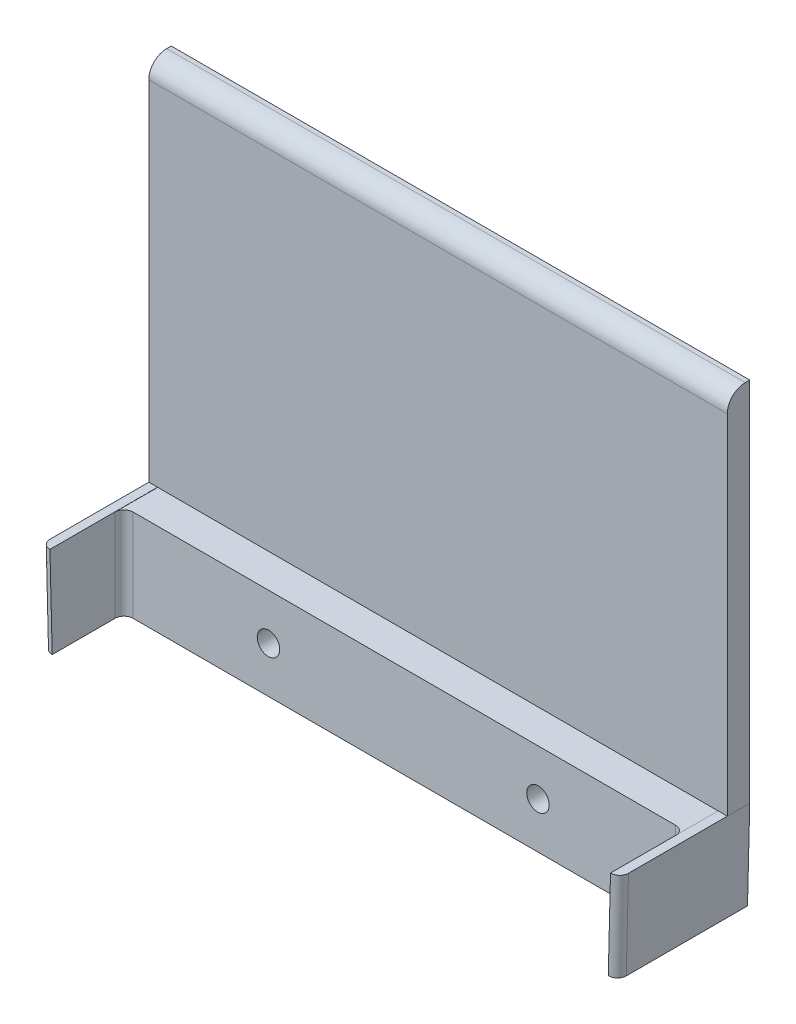
from build123d import *

# Parameters (mm, degrees)
BOSS_EXTRUDE1_DEPTH                  = 4
CUT_EXTRUDE1_DEPTH                   = 32.850274724
CUT_EXTRUDE1_DEPTH_BACK              = 32.850274724
SKETCH3_W                            = 12
SKETCH3_H                            = 10.026550622
BOSS_EXTRUDE2_DEPTH                  = 1
FILLET1_R                            = 1
BOSS_EXTRUDE3_DEPTH                  = 2.5
FILLET2_R                            = 2
SKETCH11_W                           = 1.25
SKETCH11_H                           = 14.5
TAP_DRILL_FOR_M3X0_5_TAP3_AT_2_COUNT = 2
TAP_DRILL_FOR_M3X0_5_TAP3_AT_2_PITCH = 30


with BuildPart() as part:
    # Sketch1 → Boss-Extrude1 (new body)
    with BuildSketch(Plane.XY):
        Polygon((-30.95, -5), (0, -5), (0, 5), (-31.2, 5), align=None)
        Polygon((0, 5), (0, -5), (30.95, -5), (31.2, 5), align=None)
    extrude(amount=BOSS_EXTRUDE1_DEPTH)

    # Sketch2 → Cut-Extrude1 (cut, two sides: drawn at the far end of the back side and taken through both)
    with BuildSketch(Plane(origin=(0, 0, 0), x_dir=(0, 0, -1), z_dir=(1, 0, 0)).offset(-CUT_EXTRUDE1_DEPTH_BACK)):
        Polygon((-4, -5), (-3.75, 5), (-4, 5), align=None)
    extrude(amount=CUT_EXTRUDE1_DEPTH + CUT_EXTRUDE1_DEPTH_BACK, mode=Mode.SUBTRACT)

    # Sketch3 → Boss-Extrude2 (add)
    with BuildSketch(Plane(origin=(31.055590256, -0.776389756, 0), x_dir=(0, 0, -1), z_dir=(0.9996876464081229, -0.02499219116020312, 0))):
        with Locations((-6, 0.788345395)):
            Rectangle(SKETCH3_W, SKETCH3_H)
    extrude(amount=BOSS_EXTRUDE2_DEPTH)

    # Fillet1
    fillet1_edges = [part.edges().sort_by_distance(p)[0] for p in [
        (31.075, 0, 3.875),
        (32.074980381, -0.013282795, 12),
    ]]
    fillet(fillet1_edges, radius=FILLET1_R - 0.0001)  # a hair under: the kernel refuses the full size

    # Mirror1: part across plane


with BuildPart() as part_1:
    add(part.part)
    add(part.part.mirror(Plane(origin=(0, 0, 0), x_dir=(0, 0, 1), z_dir=(1, 0, 0))))

    # Sketch4 → Boss-Extrude3 (add)
    with BuildSketch(Plane(origin=(0, 0, 0), x_dir=(-1, 0, 0), z_dir=(0, 0, -1))):
        Polygon((-32.200273116, 45.8), (-32.200273116, 4.998426601), (-31.20058547, 5.023418793), (-31.2, 5), (31.2, 5), (31.20058547, 5.023418793), (32.200273116, 4.998426601), (32.200273116, 45.8), align=None)
        Polygon((32.200273116, 4.998426601), (-32.200273116, 4.998426601), (-31.949687646, -5.024992191), (-30.95, -5), (30.95, -5), (31.949687646, -5.024992191), align=None)
    extrude(amount=BOSS_EXTRUDE3_DEPTH)


with BuildPart() as boss_extrude3_piece_1:
    # of the separate pieces the step leaves, piece 1, a body of its own (boss_extrude3_pieces)
    add(part_1.part.solids().sort_by_distance((32.200273116, 45.8, 0))[0])

    # Fillet2
    fillet2_edges = [boss_extrude3_piece_1.edges().sort_by_distance(p)[0] for p in [
        (0, 45.8, 0),
    ]]
    fillet(fillet2_edges, radius=FILLET2_R)


with BuildPart() as boss_extrude3_piece_2:
    # of the separate pieces the step leaves, piece 2, a body of its own (boss_extrude3_pieces)
    add(part_1.part.solids().sort_by_distance((-30.200412322, 5, 3.75))[0])

    # Sketch11 → Tap Drill for M3x0.5 Tap3 (revolve, cut)
    with BuildSketch(Plane(origin=(15, 0, -2.5), x_dir=(0, 1, 0), z_dir=(1, 0, 0))):
        with Locations((0.625, 7.25)):
            Rectangle(SKETCH11_W, SKETCH11_H)
    tap_drill_for_m3x0_5_tap3 = revolve(axis=Axis((15, 0, -8.85), (0, 0, 1)), mode=Mode.SUBTRACT)

    # Tap Drill for M3x0.5 Tap3 at 2: Tap Drill for M3x0.5 Tap3 ×2
    with Locations(*[(-i * TAP_DRILL_FOR_M3X0_5_TAP3_AT_2_PITCH, 0, 0) for i in range(1, TAP_DRILL_FOR_M3X0_5_TAP3_AT_2_COUNT)]):
        add(tap_drill_for_m3x0_5_tap3, mode=Mode.SUBTRACT)


solid = Compound([boss_extrude3_piece_1.part, boss_extrude3_piece_2.part])
